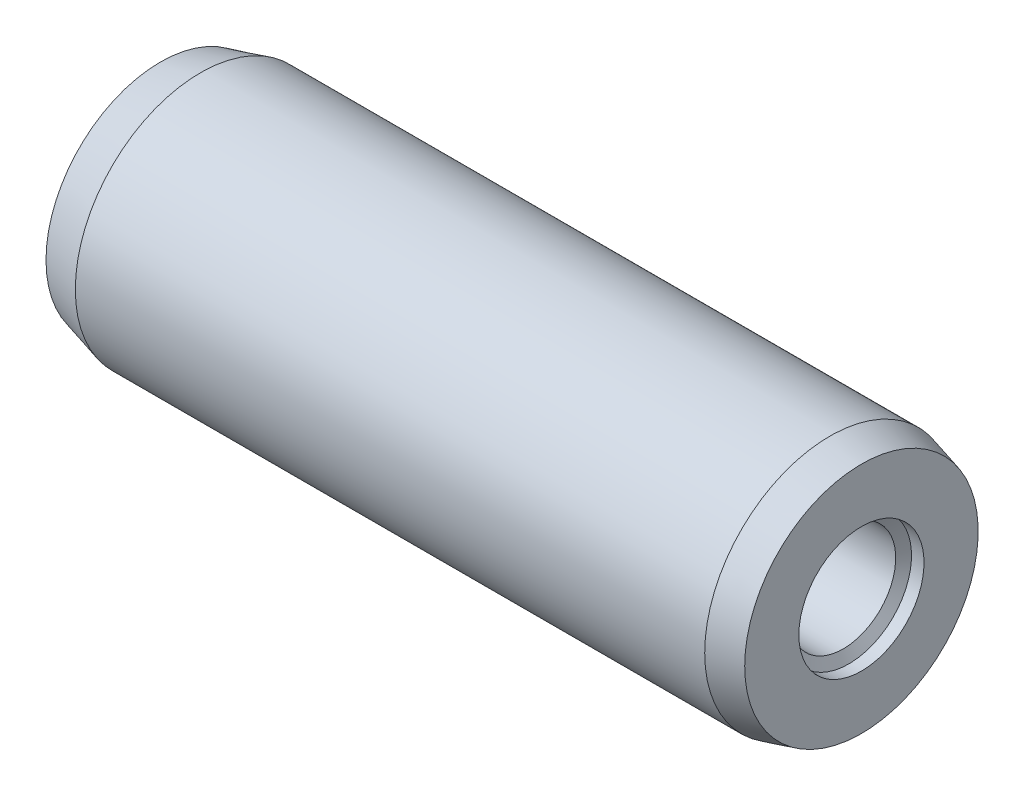
from build123d import *


with BuildPart() as part:
    # Sketch1 → Base-Revolve (revolve)
    with BuildSketch(Plane.XY):
        Polygon((0, 0), (0, 22.856406461), (8, 25), (133.7, 25), (140, 23.311920088), (140, 12.5), (137.5, 12.5), (136.345299462, 10.5), (90, 10.5), (83.6909635, 0), align=None)
    revolve(axis=Axis((-10, 0, 0), (1, 0, 0)))


solid = part.part
